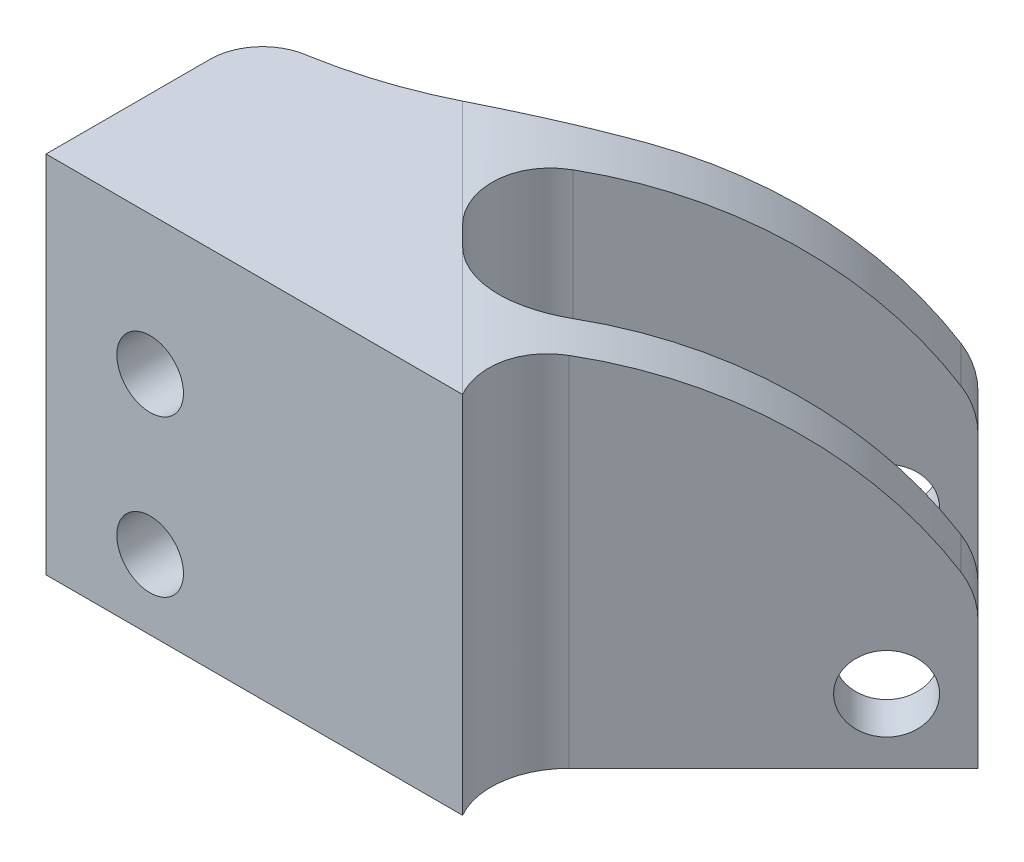
from build123d import *

# Parameters (mm, degrees)
SKETCH2_W               = 12.7
SKETCH2_H               = 22.225
SKETCH2_R               = 2.032
BOSS_EXTRUDE1_DEPTH     = 12.7
BOSS_EXTRUDE2_DEPTH     = 22.225
CUT_EXTRUDE1_DEPTH      = 55.959756427
CUT_EXTRUDE1_DEPTH_BACK = 55.959756427
SKETCH5_R               = 2.286
CUT_EXTRUDE2_DEPTH      = 55.959756427
CUT_EXTRUDE2_DEPTH_BACK = 55.959756427
FILLET1_START           = -2.63267612
FILLET1_DEPTH           = 17.0815
FILLET1_START_2         = 1.720391704
FILLET1_2_DEPTH         = 23.279608296
FILLET1_3_DEPTH         = 22.225
FILLET1_START_3         = -3.948943888
FILLET1_4_DEPTH         = 21.90945623


with BuildPart() as part:
    # Sketch2 → Boss-Extrude1 (new body)
    with BuildSketch(Plane.XY):
        with Locations((6.35, 12.832891704)):
            Rectangle(SKETCH2_W, SKETCH2_H)
        with Locations((6.35, 15.499891704)):
            Circle(SKETCH2_R, mode=Mode.SUBTRACT)
        with Locations((6.35, 5.974891704)):
            Circle(SKETCH2_R, mode=Mode.SUBTRACT)
    extrude(amount=BOSS_EXTRUDE1_DEPTH)

    # Sketch4 → Boss-Extrude2 (add)
    with BuildSketch(Plane(origin=(0, 23.945391704, 0), x_dir=(1, 0, 0), z_dir=(0, 1, 0))):
        Polygon((28.798929105, -28.031967319), (13.083480893, -12.316519107), (20.941204999, -4.458795001), (36.656653211, -20.174243213), (38.632309558, -18.198586866), (22.916861346, -2.483138654), (25.4, 0), (12.7, 0), (12.7, -12.7), (0, -12.7), (10.838416863, -14.561583137), (26.553865075, -30.277031349), align=None)
    extrude(amount=-BOSS_EXTRUDE2_DEPTH)

    # Sketch5 → Cut-Extrude1 (cut, two sides: drawn at the far end of the back side and taken through both)
    with BuildSketch(Plane(origin=(-1.861583137, 0, 1.861583137), x_dir=(0.7071067811865527, 0, 0.7071067811865424), z_dir=(-0.7071067811865424, 0, 0.7071067811865527)).offset(-CUT_EXTRUDE1_DEPTH_BACK)):
        with Locations((36.243802071, 5.657391696)):
            Circle(SKETCH5_R)
    extrude(amount=CUT_EXTRUDE1_DEPTH + CUT_EXTRUDE1_DEPTH_BACK, mode=Mode.SUBTRACT)

    # Sketch6 → Cut-Extrude2 (cut, two sides: drawn at the far end of the back side and taken through both)
    with BuildSketch(Plane(origin=(-1.861583137, 0, 1.861583137), x_dir=(0.7071067811865527, 0, 0.7071067811865424), z_dir=(-0.7071067811865424, 0, 0.7071067811865527)).offset(-CUT_EXTRUDE2_DEPTH_BACK)):
        with BuildLine():
            Line((17.960512242, 23.945391704), (40.185512242, 23.945391704))
            Line((40.185512242, 23.945391704), (40.185512242, 10.842113828))
            ThreePointArc((40.185512242, 10.842113828), (30.860575382, 20.425710965), (17.960512242, 23.945391704))
        make_face()
    extrude(amount=CUT_EXTRUDE2_DEPTH + CUT_EXTRUDE2_DEPTH_BACK, mode=Mode.SUBTRACT)

    # Fillet1: read off the stored shape, not the designer's step
    # Fillet1 outline → Fillet1 (cut)
    with BuildSketch(Plane(origin=(0, 0, 0), x_dir=(0.707106781186553, 0, 0.707106781186542), z_dir=(0.707106781186542, 0, -0.707106781186553)).offset(FILLET1_START)):
        with BuildLine():
            Line((40.185512242, -10.842113828), (40.185512242, -9.543914332))
            ThreePointArc((40.185512242, -9.543914332), (39.998674237, -10.864794174), (39.452819934, -12.082034938))
            ThreePointArc((39.452819934, -12.082034938), (39.827956058, -11.467268539), (40.185512242, -10.842113828))
        make_face()
    extrude(amount=FILLET1_DEPTH, mode=Mode.SUBTRACT)

    # Fillet1 2 outline → Fillet1 2 (cut)
    with BuildSketch(Plane(origin=(0, 0, 0), x_dir=(1, 0, 0), z_dir=(0, 1, 0)).offset(FILLET1_START_2)):
        with BuildLine():
            ThreePointArc((2.63753897, -13.153018013), (0.747340245, -12.070077877), (0, -10.023839104))
            Line((0, -10.023839104), (0, -12.7))
            Line((0, -12.7), (2.63753897, -13.153018013))
        make_face()
    extrude(amount=FILLET1_2_DEPTH, mode=Mode.SUBTRACT)

    # Fillet1 3 outline → Fillet1 3 (add)
    with BuildSketch(Plane(origin=(0, 0, 0), x_dir=(1, 0, 0), z_dir=(0, 1, 0)).offset(FILLET1_START_2)):
        with BuildLine():
            Line((10.838416863, -14.561583137), (2.884336106, -13.195407357))
            ThreePointArc((2.884336106, -13.195407357), (10.263075725, -15.672812319), (16.545160109, -20.268326383))
            Line((16.545160109, -20.268326383), (10.838416863, -14.561583137))
        make_face()
        with BuildLine():
            Line((22.916861346, -2.483138654), (26.166236401, -5.732513709))
            ThreePointArc((26.166236401, -5.732513709), (24.81331492, -2.995885603), (25.4, 0))
            Line((25.4, 0), (22.916861346, -2.483138654))
        make_face()
        with BuildLine():
            Line((20.941204999, -4.458795001), (17.573608954, -7.826391046))
            ThreePointArc((17.573608954, -7.826391046), (20.941205, -6.431487092), (24.308801045, -7.826391046))
            Line((24.308801045, -7.826391046), (20.941204999, -4.458795001))
        make_face()
        with BuildLine():
            ThreePointArc((16.451076939, -15.684115152), (15.056172984, -12.316519106), (16.451076939, -8.948923061))
            Line((16.451076939, -8.948923061), (13.083480893, -12.316519107))
            Line((13.083480893, -12.316519107), (16.451076939, -15.684115152))
        make_face()
    extrude(amount=FILLET1_3_DEPTH)

    # Fillet1 4 outline → Fillet1 4 (cut)
    with BuildSketch(Plane(origin=(0, 0, 0), x_dir=(0.707106781186553, 0, 0.707106781186542), z_dir=(0.707106781186542, 0, -0.707106781186553)).offset(FILLET1_START_3)):
        with BuildLine():
            Line((17.960512242, -23.945391704), (26.031065938, -23.945391704))
            Line((26.031065938, -23.945391704), (26.031065938, -22.629124036))
            ThreePointArc((26.031065938, -22.629124036), (22.049106057, -23.61416512), (17.960512242, -23.945391704))
        make_face()
    extrude(amount=FILLET1_4_DEPTH, mode=Mode.SUBTRACT)


with BuildPart() as body_2:
    # Mirror3: mirrored copy
    add(part.part.mirror(Plane(origin=(0, 0, -2.54), x_dir=(1, 0, 0), z_dir=(0, 0, -1))))


solid = body_2.part
